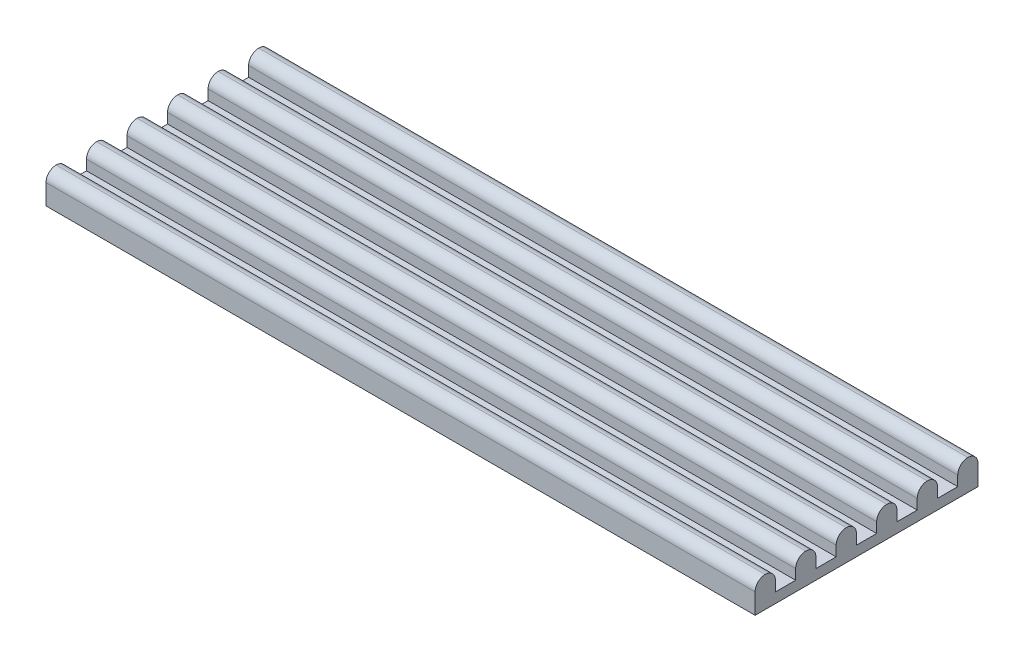
from build123d import *

# Parameters (mm, degrees)
SKETCH_1_W          = 70
SKETCH_1_H          = 22
EXTRUDE_1_DEPTH     = 3
SKETCH_2_W          = 35
SKETCH_2_H          = 2
CUT_EXTRUDE_1_DEPTH = 2
FILLET_1_R          = 1


with BuildPart() as part:
    # 草图1 → 凸台-拉伸1 (new body)
    with BuildSketch(Plane(origin=(0, 0, 0), x_dir=(1, 0, 0), z_dir=(0, 1, 0))):
        Rectangle(SKETCH_1_W, SKETCH_1_H)
    extrude(amount=EXTRUDE_1_DEPTH)

    # 草图2 → 切除-拉伸1 (cut)
    with BuildSketch(Plane(origin=(0, 3, 0), x_dir=(1, 0, 0), z_dir=(0, 1, 0))):
        with Locations((17.5, -8)):
            Rectangle(SKETCH_2_W, SKETCH_2_H)
        with Locations((-17.5, -8)):
            Rectangle(SKETCH_2_W, SKETCH_2_H)
        with Locations((-17.5, -4)):
            Rectangle(SKETCH_2_W, SKETCH_2_H)
        with Locations((17.5, -4)):
            Rectangle(SKETCH_2_W, SKETCH_2_H)
        with Locations((17.5, 0)):
            Rectangle(SKETCH_2_W, SKETCH_2_H)
        with Locations((-17.5, 0)):
            Rectangle(SKETCH_2_W, SKETCH_2_H)
        with Locations((-17.5, 4)):
            Rectangle(SKETCH_2_W, SKETCH_2_H)
        with Locations((17.5, 4)):
            Rectangle(SKETCH_2_W, SKETCH_2_H)
        with Locations((17.5, 8)):
            Rectangle(SKETCH_2_W, SKETCH_2_H)
        with Locations((-17.5, 8)):
            Rectangle(SKETCH_2_W, SKETCH_2_H)
    extrude(amount=-CUT_EXTRUDE_1_DEPTH, mode=Mode.SUBTRACT)

    # 圆角1
    fillet_1_edges = [part.edges().sort_by_distance(p)[0] for p in [
        (0, 3, 11),
        (0, 3, 9),
        (0, 3, 7),
        (0, 3, 5),
        (0, 3, 3),
        (0, 3, 1),
        (0, 3, -1),
        (0, 3, -3),
        (0, 3, -5),
        (0, 3, -7),
        (0, 3, -9),
        (0, 3, -11),
    ]]
    fillet(fillet_1_edges, radius=FILLET_1_R - 0.0001)  # a hair under: the kernel refuses the full size


solid = part.part
